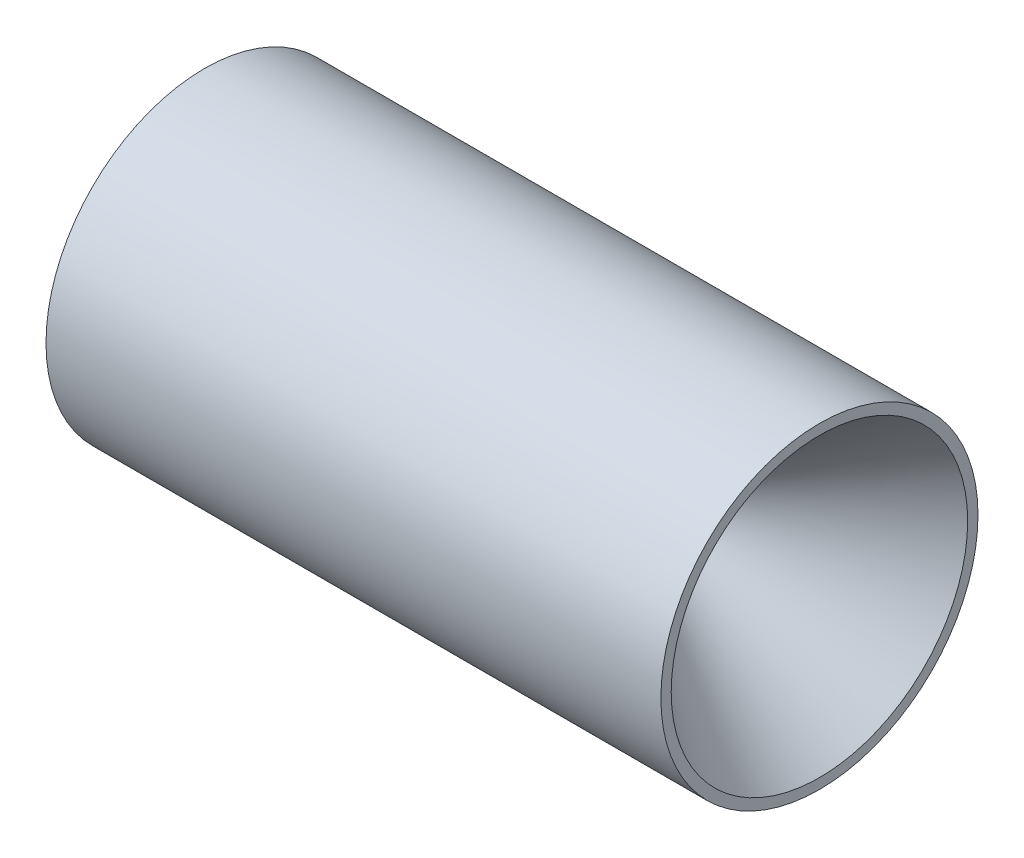
from build123d import *

# Parameters (mm, degrees)
SKETCH1_R           = 45.847
BOSS_EXTRUDE1_DEPTH = 177.8


with BuildPart() as part:
    # Sketch1 → Boss-Extrude1 (new body)
    with BuildSketch(Plane(origin=(0, 0, 0), x_dir=(0, 0, -1), z_dir=(1, 0, 0))):
        Circle(SKETCH1_R)
    extrude(amount=BOSS_EXTRUDE1_DEPTH)

    # Sketch3 → Cut-Revolve1 (revolve, cut)
    with BuildSketch(Plane.XY):
        Polygon((0, 0), (0, 42.8625), (127, 9.525), (133.35, 9.525), (177.8, 42.8625), (177.8, 0), align=None)
    revolve(axis=Axis((0, 0, 0), (1, 0, 0)), mode=Mode.SUBTRACT)


solid = part.part
